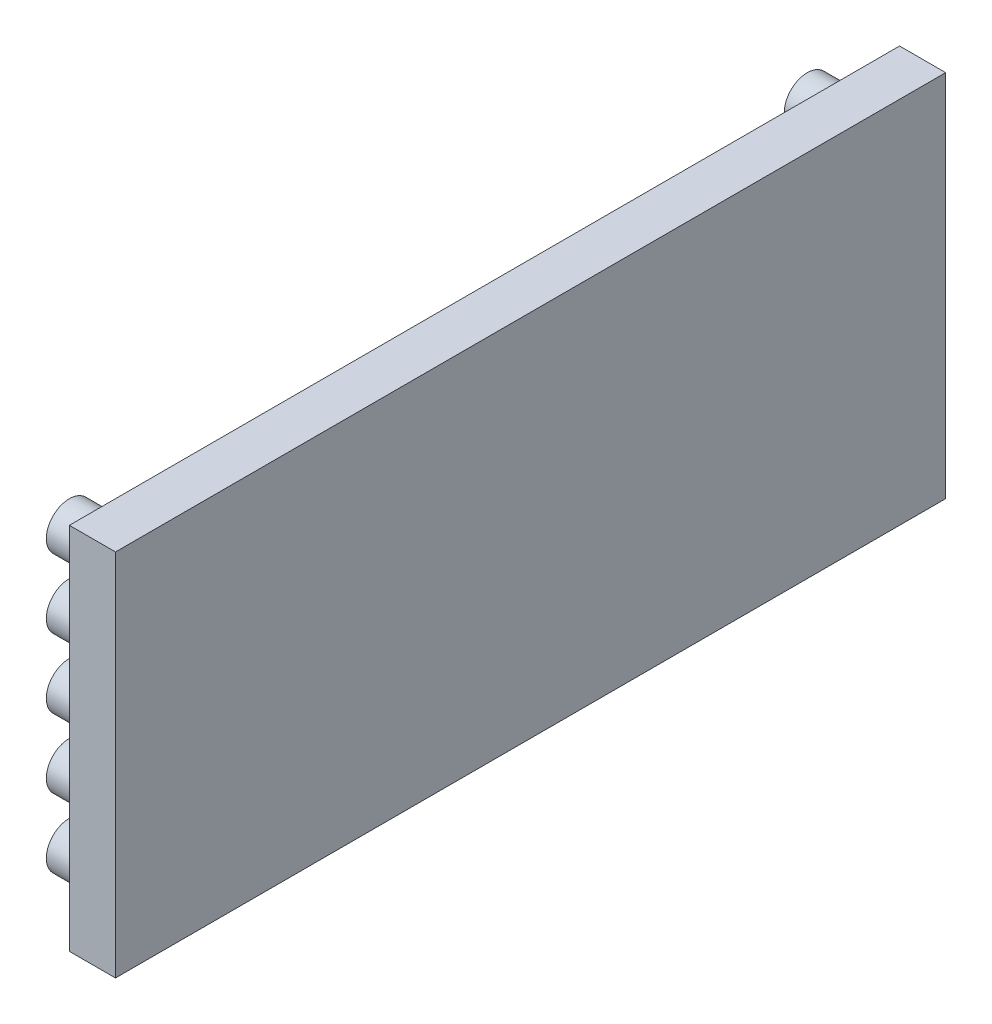
from build123d import *

# Parameters (mm, degrees)
SKETCH1_W           = 457.2
SKETCH1_H           = 203.2
BOSS_EXTRUDE1_DEPTH = 12.7
SKETCH2_R           = 12.7
BOSS_EXTRUDE2_DEPTH = 25.4


with BuildPart() as part:
    # Sketch1 → Boss-Extrude1 (new, symmetric)
    with BuildSketch(Plane(origin=(0, 0, 0), x_dir=(0, 0, -1), z_dir=(1, 0, 0))):
        with Locations((228.6, 101.6)):
            Rectangle(SKETCH1_W, SKETCH1_H)
    extrude(amount=BOSS_EXTRUDE1_DEPTH, both=True)

    # Sketch2 → Boss-Extrude2 (add)
    with BuildSketch(Plane.ZY.offset(12.7)):
        with Locations((-25.4, 177.8)):
            Circle(SKETCH2_R)
        with Locations((-25.4, 139.7)):
            Circle(SKETCH2_R)
        with Locations((-25.4, 101.6)):
            Circle(SKETCH2_R)
        with Locations((-25.4, 63.5)):
            Circle(SKETCH2_R)
        with Locations((-25.4, 25.4)):
            Circle(SKETCH2_R)
        with Locations((-431.8, 139.7)):
            Circle(SKETCH2_R)
        with Locations((-431.8, 101.6)):
            Circle(SKETCH2_R)
        with Locations((-431.8, 63.5)):
            Circle(SKETCH2_R)
        with Locations((-431.8, 25.4)):
            Circle(SKETCH2_R)
        with Locations((-431.8, 177.8)):
            Circle(SKETCH2_R)
    extrude(amount=BOSS_EXTRUDE2_DEPTH)


solid = part.part
